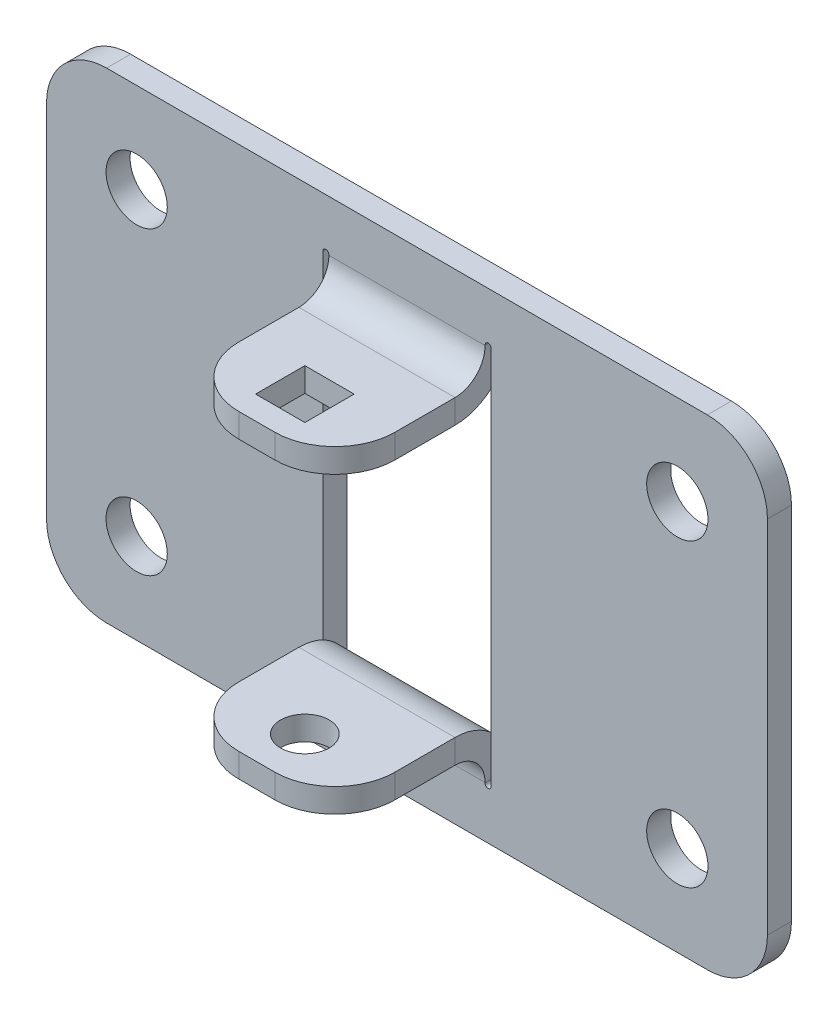
from build123d import *

# Parameters (mm, degrees)
SKETCH_1_W        = 120
SKETCH_1_H        = 80
SKETCH_1_W_2      = 28
SKETCH_1_H_2      = 45
BASE_PLATE_DEPTH  = 4
TABS2_START       = -5
TABS2_DEPTH       = 10
TABS2_2_OUTLINE_W = 26
TABS2_2_OUTLINE_H = 4
TABS2_2_DEPTH     = 1.41096
TABS2_START_2     = 5
TABS2_3_OUTLINE_W = 26
TABS2_3_OUTLINE_H = 4
TABS2_3_DEPTH     = 20
TABS2_START_3     = -13
TABS2_4_DEPTH     = 26
TABS2_5_DEPTH     = 26
HOLES_DEPTH       = 77.321687612
HOLES_DEPTH_BACK  = 77.321687612
SKETCH_10_R       = 4.05
SKETCH_12_W       = 8.2
SKETCH_12_H       = 8.2
HOLE2_DEPTH       = 4
FILLET_2_R        = 10
SKETCH_11_R       = 5.1
MOUNT_HOLES_DEPTH = 4


with BuildPart() as part:
    # Base Plate: sheet metal written as solids
    # Sketch 1 → Base Plate (new body)
    with BuildSketch(Plane.XY):
        Rectangle(SKETCH_1_W, SKETCH_1_H)
        Rectangle(SKETCH_1_W_2, SKETCH_1_H_2, mode=Mode.SUBTRACT)
    extrude(amount=-BASE_PLATE_DEPTH)

    # Tabs2: read off the stored shape, not the designer's step
    # Tabs2 outline → Tabs2 (cut)
    with BuildSketch(Plane.XY.offset(TABS2_START)):
        with BuildLine():
            ThreePointArc((-13, 31.6), (-13.5, 32.1), (-14, 31.6))
            Line((-14, 31.6), (-14, 22.5))
            Line((-14, 22.5), (-13, 22.5))
            Line((-13, 22.5), (-13, 31.6))
        make_face()
        with BuildLine():
            Line((-13, -22.5), (-14, -22.5))
            Line((-14, -22.5), (-14, -31.6))
            ThreePointArc((-14, -31.6), (-13.5, -32.1), (-13, -31.6))
            Line((-13, -31.6), (-13, -22.5))
        make_face()
        with BuildLine():
            Line((13, 31.6), (13, 22.5))
            Line((13, 22.5), (14, 22.5))
            Line((14, 22.5), (14, 31.6))
            ThreePointArc((14, 31.6), (13.5, 32.1), (13, 31.6))
        make_face()
        with BuildLine():
            Line((14, -22.5), (13, -22.5))
            Line((13, -22.5), (13, -31.6))
            ThreePointArc((13, -31.6), (13.5, -32.1), (14, -31.6))
            Line((14, -31.6), (14, -22.5))
        make_face()
    extrude(amount=TABS2_DEPTH, mode=Mode.SUBTRACT)

    # Tabs2 2 outline → Tabs2 2 (cut)
    with BuildSketch(Plane.XY.offset(TABS2_START)):
        with Locations((0, 24.5)):
            Rectangle(TABS2_2_OUTLINE_W, TABS2_2_OUTLINE_H)
        with Locations((0, -24.5)):
            Rectangle(TABS2_2_OUTLINE_W, TABS2_2_OUTLINE_H)
    extrude(amount=TABS2_2_DEPTH, mode=Mode.SUBTRACT)

    # Tabs2 4 outline → Tabs2 4 (cut)
    with BuildSketch(Plane.YZ.offset(TABS2_START_3)):
        with BuildLine():
            ThreePointArc((31.5, -4), (27.257359313, -2.937253933), (24.016685226, 0))
            Line((24.016685226, 0), (22.5, 0))
            Line((22.5, 0), (22.5, -3.58904))
            Line((22.5, -3.58904), (26.5, -3.58904))
            Line((26.5, -3.58904), (26.5, -4))
            Line((26.5, -4), (31.5, -4))
        make_face()
        with BuildLine():
            Line((-22.5, -3.58904), (-22.5, 0))
            Line((-22.5, 0), (-24.016685226, 0))
            ThreePointArc((-24.016685226, 0), (-27.257359313, -2.937253933), (-31.5, -4))
            Line((-31.5, -4), (-26.5, -4))
            Line((-26.5, -4), (-26.5, -3.58904))
            Line((-26.5, -3.58904), (-22.5, -3.58904))
        make_face()
    extrude(amount=TABS2_4_DEPTH, mode=Mode.SUBTRACT)



with BuildPart() as body_2:
    # Tabs2 3 outline → Tabs2 3 (new body)
    with BuildSketch(Plane.XY.offset(TABS2_START_2)):
        with Locations((0, 24.5)):
            Rectangle(TABS2_3_OUTLINE_W, TABS2_3_OUTLINE_H)
        with Locations((0, -24.5)):
            Rectangle(TABS2_3_OUTLINE_W, TABS2_3_OUTLINE_H)
    extrude(amount=TABS2_3_DEPTH)


with BuildPart() as part_1:
    add(part.part)

    add(body_2.part)  # Tabs2 5 merges body 2
    # Tabs2 5 outline → Tabs2 5 (add)
    with BuildSketch(Plane.YZ.offset(TABS2_START_3)):
        with BuildLine():
            Line((26.5, 5), (22.5, 5))
            ThreePointArc((22.5, 5), (22.88751392, 2.38751392), (24.016685226, 0))
            Line((24.016685226, 0), (31.5, 0))
            ThreePointArc((31.5, 0), (27.964466094, 1.464466094), (26.5, 5))
        make_face()
        with BuildLine():
            Line((-31.5, 0), (-24.016685226, 0))
            ThreePointArc((-24.016685226, 0), (-22.88751392, 2.38751392), (-22.5, 5))
            Line((-22.5, 5), (-26.5, 5))
            ThreePointArc((-26.5, 5), (-27.964466094, 1.464466094), (-31.5, 0))
        make_face()
    extrude(amount=TABS2_5_DEPTH)

    # Эскиз10 → Holes (cut, two sides: drawn at the far end of the back side and taken through both)
    with BuildSketch(Plane(origin=(0, 0, 0), x_dir=(1, 0, 0), z_dir=(0, 1, 0)).offset(-HOLES_DEPTH_BACK)):
        with Locations(Location((0, -17, 0), (0, 0, 90))):
            Circle(SKETCH_10_R)
    extrude(amount=HOLES_DEPTH + HOLES_DEPTH_BACK, mode=Mode.SUBTRACT)

    # Эскиз12 → Hole2 (cut)
    with BuildSketch(Plane(origin=(0, 26.5, 0), x_dir=(1, 0, 0), z_dir=(0, 1, 0))):
        with Locations((0, -17)):
            Rectangle(SKETCH_12_W, SKETCH_12_H)
    extrude(amount=-HOLE2_DEPTH, mode=Mode.SUBTRACT)

    # Fillet 2
    fillet_2_edges = [part_1.edges().sort_by_distance(p)[0] for p in [
        (13, -24.5, 25),
        (-13, -24.5, 25),
        (-60, 40, -2),
        (60, 40, -2),
        (60, -40, -2),
        (-60, -40, -2),
        (-13, 24.5, 25),
        (13, 24.5, 25),
    ]]
    fillet(fillet_2_edges, radius=FILLET_2_R)

    # Эскиз11 → Mount Holes (cut)
    with BuildSketch(Plane.XY):
        with Locations((-45, 25)):
            Circle(SKETCH_11_R)
        with Locations((45, 25)):
            Circle(SKETCH_11_R)
        with Locations((-45, -25)):
            Circle(SKETCH_11_R)
        with Locations((45, -25)):
            Circle(SKETCH_11_R)
    extrude(amount=-MOUNT_HOLES_DEPTH, mode=Mode.SUBTRACT)


solid = part_1.part
